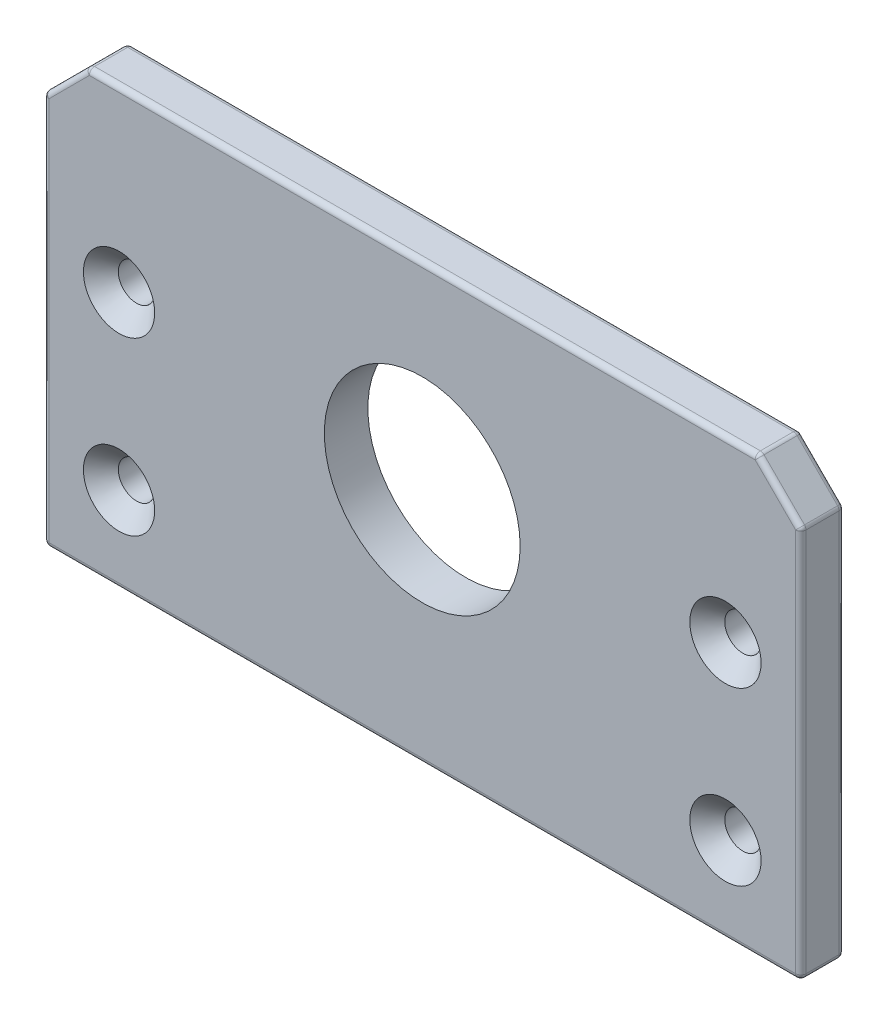
from build123d import *

# Parameters (mm, degrees)
SKETCH2_W                                       = 110.49
SKETCH2_H                                       = 6.35
BOSS_EXTRUDE1_DEPTH                             = 63.5
SKETCH3_R                                       = 14.2875
CUT_EXTRUDE1_DEPTH                              = 85.407242136
CHAMFER1_SIZE                                   = 6.35
FILLET2_R                                       = 0.762
CSK_FOR_M5_FLAT_HEAD_MACHINE_SCREW1_D           = 5.3
CSK_FOR_M5_FLAT_HEAD_MACHINE_SCREW1_CSINK_D     = 10.4
CSK_FOR_M5_FLAT_HEAD_MACHINE_SCREW1_CSINK_ANGLE = 90


with BuildPart() as part:
    # Sketch2 → Boss-Extrude1 (new body)
    with BuildSketch(Plane(origin=(0, 0, 0), x_dir=(1, 0, 0), z_dir=(0, 1, 0))):
        Rectangle(SKETCH2_W, SKETCH2_H)
    extrude(amount=-BOSS_EXTRUDE1_DEPTH)

    # Sketch3 → Cut-Extrude1 (cut, through all)
    with BuildSketch(Plane.XY.offset(3.175)):
        with Locations((0, -28.8150046)):
            Circle(SKETCH3_R)
    extrude(amount=-CUT_EXTRUDE1_DEPTH, mode=Mode.SUBTRACT)

    # Chamfer1
    chamfer1_edges = [part.edges().sort_by_distance(p)[0] for p in [
        (-55.245, 0, 0),
        (55.245, 0, 0),
    ]]
    chamfer(chamfer1_edges, length=CHAMFER1_SIZE)

    # Fillet2
    fillet2_edges = [part.edges().sort_by_distance(p)[0] for p in [
        (0, -63.5, 3.175),
        (0, -63.5, -3.175),
        (55.245, -63.5, 0),
        (55.245, -34.925, 3.175),
        (55.245, -34.925, -3.175),
        (52.07, -3.175, -3.175),
        (55.245, -6.35, 0),
        (52.07, -3.175, 3.175),
        (48.895, 0, 0),
        (0, 0, 3.175),
        (0, 0, -3.175),
        (-48.895, 0, 0),
        (-52.07, -3.175, 3.175),
        (-52.07, -3.175, -3.175),
        (-55.245, -63.5, 0),
        (-55.245, -34.925, -3.175),
        (-55.245, -6.35, 0),
        (-55.245, -34.925, 3.175),
    ]]
    fillet(fillet2_edges, radius=FILLET2_R)

    # CSK for M5 Flat Head Machine Screw1 (through all)
    with Locations(Plane.XY.offset(3.175)):
        with Locations((-44.245, -26), (-44.245, -51), (44.245, -51), (44.245, -26)):
            CounterSinkHole(CSK_FOR_M5_FLAT_HEAD_MACHINE_SCREW1_D / 2, CSK_FOR_M5_FLAT_HEAD_MACHINE_SCREW1_CSINK_D / 2, counter_sink_angle=CSK_FOR_M5_FLAT_HEAD_MACHINE_SCREW1_CSINK_ANGLE)


solid = part.part
